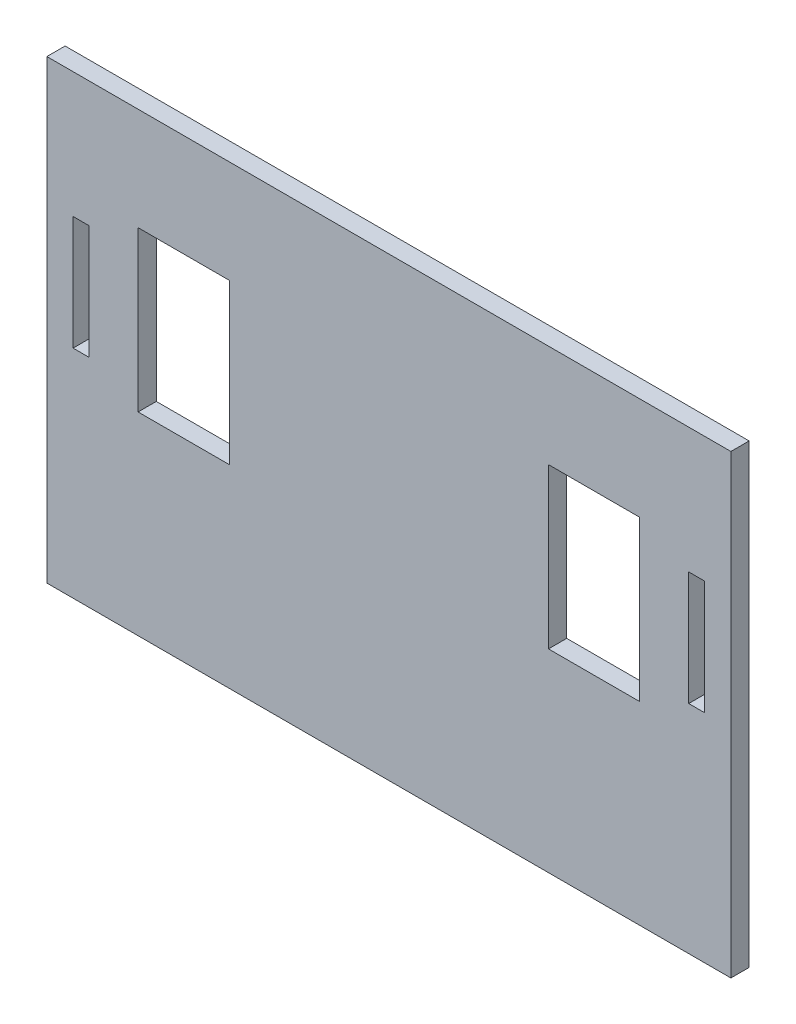
from build123d import *

# Parameters (mm, degrees)
ESQUISSE1_W             = 300
ESQUISSE1_H             = 200
BOSS_EXTRU_1_DEPTH      = 8
ESQUISSE2_W             = 40
ESQUISSE2_H             = 70
ESQUISSE2_W_2           = 7
ESQUISSE2_H_2           = 50
ENL_V_MAT_EXTRU_1_DEPTH = 361.643868657


with BuildPart() as part:
    # Esquisse1 → Boss.-Extru.1 (new body)
    with BuildSketch(Plane.XY):
        with Locations((150, 100)):
            Rectangle(ESQUISSE1_W, ESQUISSE1_H)
    extrude(amount=BOSS_EXTRU_1_DEPTH)

    # Esquisse2 → Enlèv. mat.-Extru.1 (cut, through all)
    with BuildSketch(Plane.XY.offset(8)):
        with Locations((60, 120)):
            Rectangle(ESQUISSE2_W, ESQUISSE2_H)
        with Locations((15, 120)):
            Rectangle(ESQUISSE2_W_2, ESQUISSE2_H_2)
        with Locations((285, 120)):
            Rectangle(ESQUISSE2_W_2, ESQUISSE2_H_2)
        with Locations((240, 120)):
            Rectangle(ESQUISSE2_W, ESQUISSE2_H)
    extrude(amount=-ENL_V_MAT_EXTRU_1_DEPTH, mode=Mode.SUBTRACT)


solid = part.part
